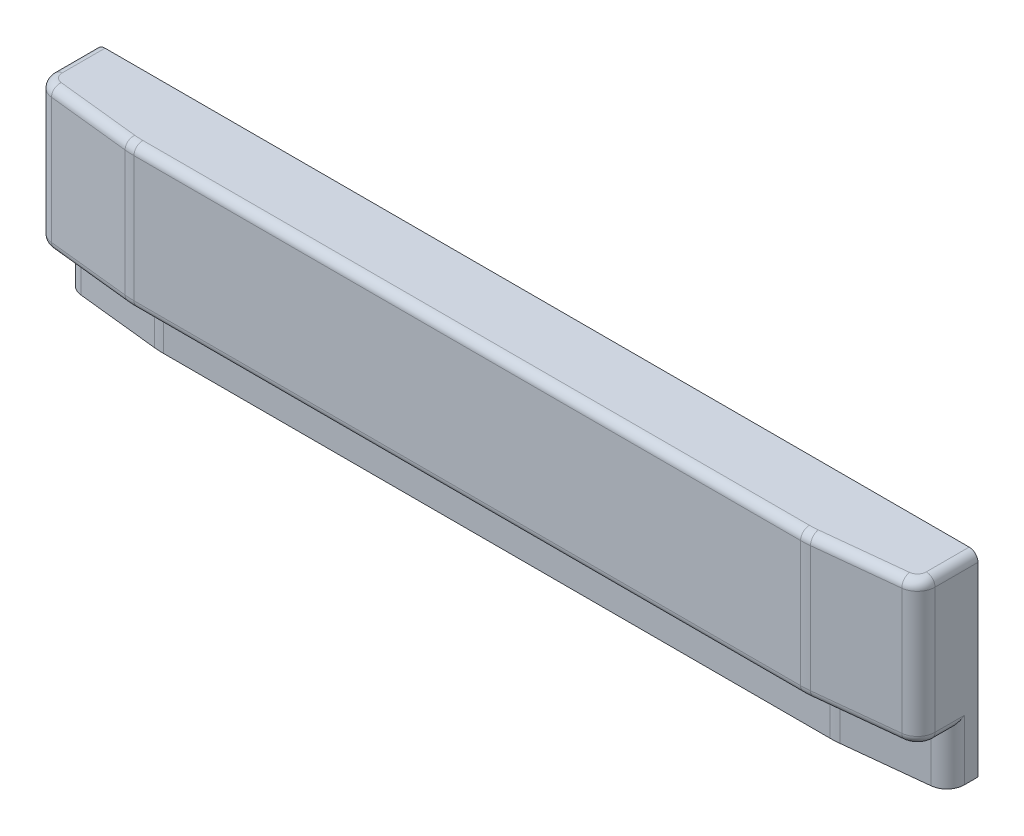
from build123d import *

# Parameters (mm, degrees)
BOSS_EXTRUDE1_DEPTH = 168.275
CUT_EXTRUDE1_DEPTH  = 44.45
FILLET1_R           = 15.24
FILLET2_R           = 76.2
FILLET3_R           = 7.62
FILLET4_R           = 7.62


with BuildPart() as part:
    # Sketch7 → Boss-Extrude1 (new body)
    with BuildSketch(Plane(origin=(0, 0, 0), x_dir=(1, 0, 0), z_dir=(0, 1, 0))):
        Polygon((0, 0), (762, 0), (762, -50.8), (673.1, -60.325), (88.9, -60.325), (0, -50.8), align=None)
    extrude(amount=BOSS_EXTRUDE1_DEPTH)

    # Sketch10 → Cut-Extrude1 (cut)
    with BuildSketch(Plane.XZ):
        Polygon((0, 50.8), (0, 25.4), (88.9, 34.925), (673.1, 34.925), (762, 25.4), (762, 50.8), (673.1, 60.325), (88.9, 60.325), align=None)
    extrude(amount=-CUT_EXTRUDE1_DEPTH, mode=Mode.SUBTRACT)

    # Fillet1
    fillet1_edges = [part.edges().sort_by_distance(p)[0] for p in [
        (762, 22.225, 25.4),
        (762, 106.3625, 50.8),
        (0, 22.225, 25.4),
        (0, 106.3625, 50.8),
    ]]
    fillet(fillet1_edges, radius=FILLET1_R)

    # Fillet2
    fillet2_edges = [part.edges().sort_by_distance(p)[0] for p in [
        (673.1, 22.225, 34.925),
        (673.1, 106.3625, 60.325),
        (88.9, 22.225, 34.925),
        (88.9, 106.3625, 60.325),
    ]]
    fillet(fillet2_edges, radius=FILLET2_R)

    # Fillet3
    fillet3_edges = [part.edges().sort_by_distance(p)[0] for p in [
        (0, 168.275, 18.552816133),
        (3.904199904, 168.275, 47.291761863),
        (49.234552732, 168.275, 56.07513065),
        (88.905795265, 168.275, 60.216512154),
        (762, 168.275, 18.552816133),
        (758.095800096, 168.275, 47.291761863),
        (712.765447268, 168.275, 56.07513065),
        (673.094204735, 168.275, 60.216512154),
        (381, 168.275, 60.325),
    ]]
    fillet(fillet3_edges, radius=FILLET3_R)

    # Fillet4
    fillet4_edges = [part.edges().sort_by_distance(p)[0] for p in [
        (762, 44.45, 24.405632265),
        (758.095800096, 44.45, 47.291761863),
        (712.765447268, 44.45, 56.07513065),
        (673.094204735, 44.45, 60.216512154),
        (0, 44.45, 24.405632265),
        (3.904199904, 44.45, 47.291761863),
        (49.234552732, 44.45, 56.07513065),
        (88.905795265, 44.45, 60.216512154),
        (381, 44.45, 60.325),
    ]]
    fillet(fillet4_edges, radius=FILLET4_R)


solid = part.part
